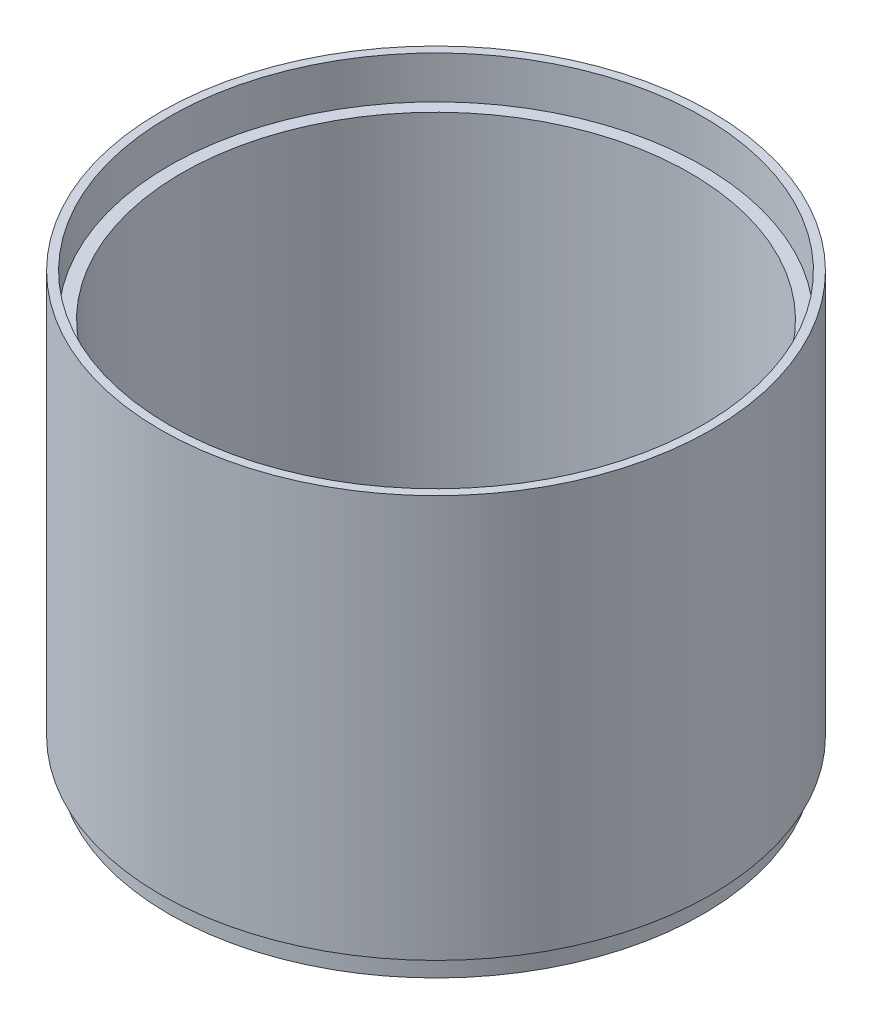
from build123d import *


with BuildPart() as part:
    # Szkic1 → Obrót1 (revolve)
    with BuildSketch(Plane.XY):
        Polygon((-63, 5), (-63, 0), (-60, 0), (-60, 90), (-63, 90), (-63, 100), (-65, 100), (-65, 28.561789866), (-65, 5), align=None)
    revolve(axis=Axis((0, 35.541039942, 0), (0, -1, 0)))


solid = part.part
